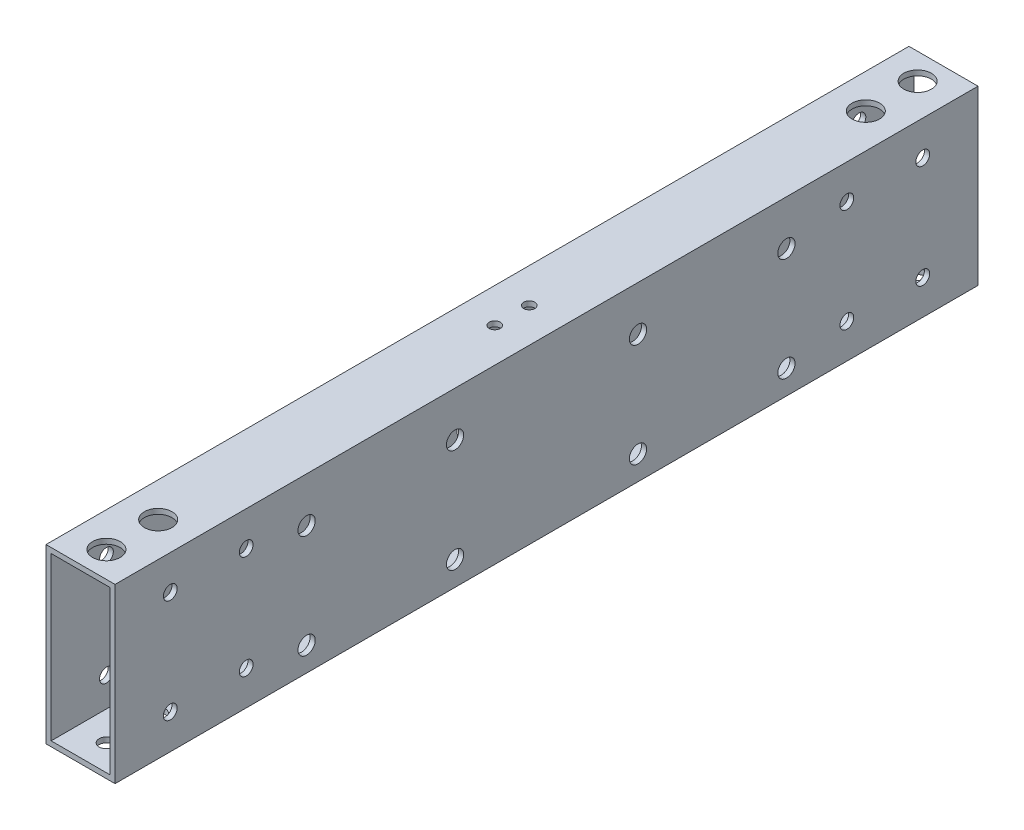
from build123d import *

# Parameters (mm, degrees)
SKETCH_1_W          = 20
SKETCH_1_H          = 50
SKETCH_1_W_2        = 17
SKETCH_1_H_2        = 47
EXTRUDE_1_DEPTH     = 250
SKETCH_2_R          = 2.5
CUT_EXTRUDE_1_DEPTH = 253.041663223
SKETCH_3_R          = 2.1
CUT_EXTRUDE_2_DEPTH = 256.147016443
SKETCH_4_R          = 1.6
CUT_EXTRUDE_3_DEPTH = 10
SKETCH_5_R          = 4
CUT_EXTRUDE_4_DEPTH = 10
SKETCH_6_R          = 7.5
CUT_EXTRUDE_5_DEPTH = 10
SKETCH_7_R          = 2
CUT_EXTRUDE_6_DEPTH = 253.041663223


with BuildPart() as part:
    # 草图1 → 凸台-拉伸1 (new body)
    with BuildSketch(Plane.XY):
        Rectangle(SKETCH_1_W, SKETCH_1_H)
        Rectangle(SKETCH_1_W_2, SKETCH_1_H_2, mode=Mode.SUBTRACT)
    extrude(amount=-EXTRUDE_1_DEPTH)

    # 草图2 → 切除-拉伸1 (cut, through all)
    with BuildSketch(Plane.ZY.offset(10)):
        with Locations((-55.5, 12)):
            Circle(SKETCH_2_R)
        with Locations((-98.5, 12)):
            Circle(SKETCH_2_R)
        with Locations((-98.5, -18)):
            Circle(SKETCH_2_R)
        with Locations((-55.5, -18)):
            Circle(SKETCH_2_R)
        with Locations((-194.5, -18)):
            Circle(SKETCH_2_R)
        with Locations((-151.5, -18)):
            Circle(SKETCH_2_R)
        with Locations((-151.5, 12)):
            Circle(SKETCH_2_R)
        with Locations((-194.5, 12)):
            Circle(SKETCH_2_R)
    extrude(amount=-CUT_EXTRUDE_1_DEPTH, mode=Mode.SUBTRACT)

    # 草图3 → 切除-拉伸2 (cut, through all)
    with BuildSketch(Plane(origin=(0, 25, 0), x_dir=(1, 0, 0), z_dir=(0, 1, 0))):
        with Locations((0, 22.5)):
            Circle(SKETCH_3_R)
        with Locations((0, 7.5)):
            Circle(SKETCH_3_R)
        with Locations((0, 242.5)):
            Circle(SKETCH_3_R)
        with Locations((0, 227.5)):
            Circle(SKETCH_3_R)
    extrude(amount=-CUT_EXTRUDE_2_DEPTH, mode=Mode.SUBTRACT)

    # 草图4 → 切除-拉伸3 (cut)
    with BuildSketch(Plane(origin=(0, 25, 0), x_dir=(1, 0, 0), z_dir=(0, 1, 0))):
        with Locations((0, 130)):
            Circle(SKETCH_4_R)
        with Locations((0, 120)):
            Circle(SKETCH_4_R)
    extrude(amount=-CUT_EXTRUDE_3_DEPTH, mode=Mode.SUBTRACT)

    # 草图5 → 切除-拉伸4 (cut)
    with BuildSketch(Plane(origin=(0, 25, 0), x_dir=(1, 0, 0), z_dir=(0, 1, 0))):
        with Locations((0, 22.5)):
            Circle(SKETCH_5_R)
        with Locations((0, 7.5)):
            Circle(SKETCH_5_R)
        with Locations((0, 242.5)):
            Circle(SKETCH_5_R)
        with Locations((0, 227.5)):
            Circle(SKETCH_5_R)
    extrude(amount=-CUT_EXTRUDE_4_DEPTH, mode=Mode.SUBTRACT)

    # 草图6 → 切除-拉伸5 (cut)
    with BuildSketch(Plane.ZY.offset(10)):
        with Locations((-125, -4)):
            Circle(SKETCH_6_R)
    extrude(amount=-CUT_EXTRUDE_5_DEPTH, mode=Mode.SUBTRACT)

    # 草图7 → 切除-拉伸6 (cut, through all)
    with BuildSketch(Plane.ZY.offset(10)):
        with Locations((-234, 15)):
            Circle(SKETCH_7_R)
        with Locations((-212, 15)):
            Circle(SKETCH_7_R)
        with Locations((-234, -15)):
            Circle(SKETCH_7_R)
        with Locations((-212, -15)):
            Circle(SKETCH_7_R)
        with Locations((-38, -15)):
            Circle(SKETCH_7_R)
        with Locations((-16, -15)):
            Circle(SKETCH_7_R)
        with Locations((-38, 15)):
            Circle(SKETCH_7_R)
        with Locations((-16, 15)):
            Circle(SKETCH_7_R)
    extrude(amount=-CUT_EXTRUDE_6_DEPTH, mode=Mode.SUBTRACT)


solid = part.part
